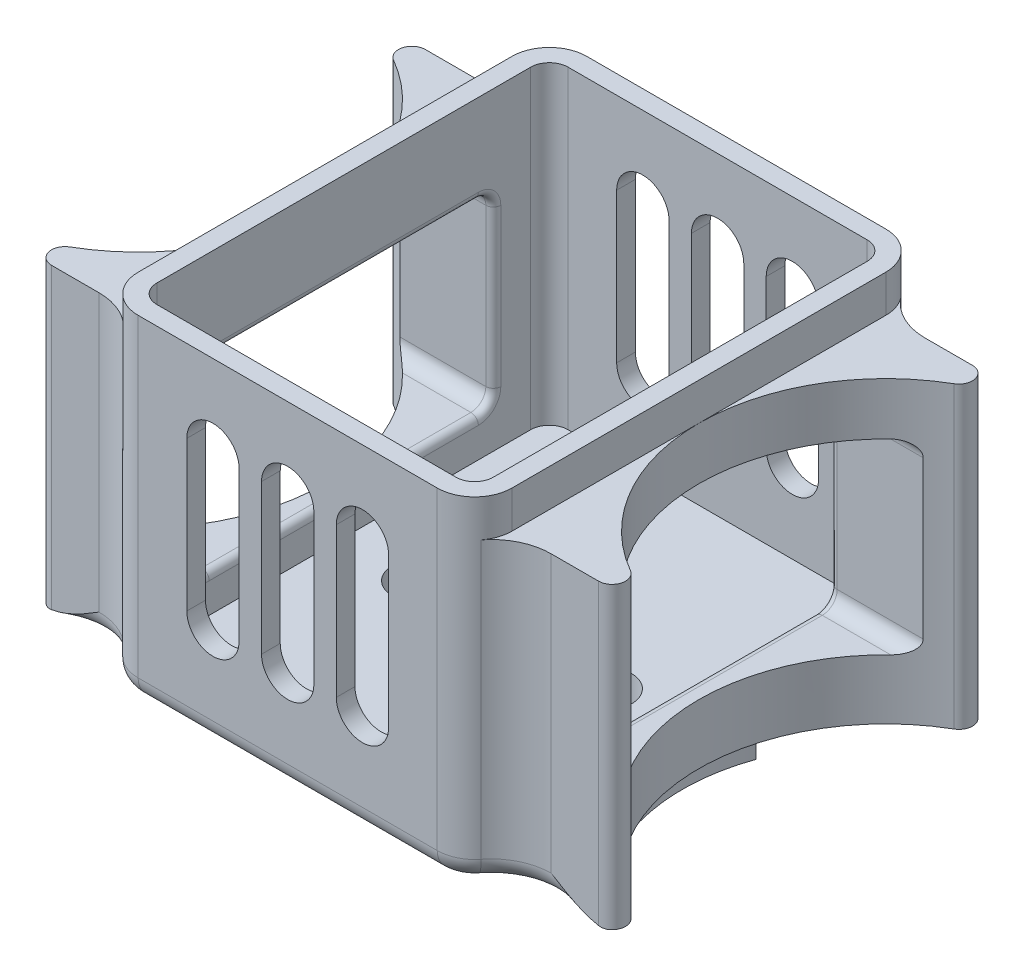
from build123d import *

# Parameters (mm, degrees)
SALIENTE_EXTRUIR1_DEPTH    = 45
CORTAR_EXTRUIR1_DEPTH      = 42
CORTAR_EXTRUIR2_START      = -5
CORTAR_EXTRUIR2_DEPTH      = 5
CROQUIS6_W                 = 30
CROQUIS6_H                 = 2
SALIENTE_EXTRUIR3_DEPTH    = 5
SALIENTE_EXTRUIR4_DEPTH    = 3.5
CORTAR_EXTRUIR5_DEPTH      = 74.654599313
CORTAR_EXTRUIR5_DEPTH_BACK = 74.654599313
REDONDEO1_R                = 1.8
REDONDEO5_R                = 8
REDONDEO6_R                = 8
REDONDEO7_R                = 3
REDONDEO8_R                = 3
CORTAR_EXTRUIR6_DEPTH      = 83.489697253
CORTAR_EXTRUIR6_DEPTH_BACK = 83.489697253
CORTAR_EXTRUIR7_DEPTH      = 69.742637081
CORTAR_EXTRUIR7_DEPTH_BACK = 10
CROQUIS9_R                 = 1.55
REDONDEO9_R                = 1
CROQUIS14_R                = 3.5
CORTAR_EXTRUIR8_DEPTH      = 4


with BuildPart() as part:
    # Croquis1 → Saliente-Extruir1 (new body)
    with BuildSketch(Plane(origin=(0, 0, 0), x_dir=(1, 0, 0), z_dir=(0, 1, 0))):
        with BuildLine():
            Line((20, 30), (-20, 30))
            ThreePointArc((-20, 30), (-23.535533906, 28.535533906), (-25, 25))
            Line((-25, 25), (-25, -25))
            ThreePointArc((-25, -25), (-23.535533906, -28.535533906), (-20, -30))
            Line((-20, -30), (20, -30))
            ThreePointArc((20, -30), (23.535533906, -28.535533906), (25, -25))
            Line((25, -25), (25, 25))
            ThreePointArc((25, 25), (23.535533906, 28.535533906), (20, 30))
        make_face()
        with BuildLine():
            ThreePointArc((-50, 25), (-32.32233048, 17.677669539), (-25, 2.6e-08))
            Line((-25, 2.6e-08), (-25, 25))
            Line((-25, 25), (-50, 25))
        make_face()
        with BuildLine():
            Line((-50, -25), (-25, -25))
            Line((-25, -25), (-25, 2.6e-08))
            ThreePointArc((-25, 2.6e-08), (-32.322330461, -17.67766952), (-50, -25))
        make_face()
        with BuildLine():
            Line((25, 3.4e-08), (25, -25))
            Line((25, -25), (50, -25))
            ThreePointArc((50, -25), (32.322330458, -17.677669518), (25, 3.4e-08))
        make_face()
        with BuildLine():
            Line((25, 25), (25, 3.4e-08))
            ThreePointArc((25, 3.4e-08), (32.322330482, 17.677669542), (50, 25))
            Line((50, 25), (25, 25))
        make_face()
    extrude(amount=SALIENTE_EXTRUIR1_DEPTH)

    # Croquis2 → Cortar-Extruir1 (cut)
    with BuildSketch(Plane(origin=(0, 45, 0), x_dir=(1, 0, 0), z_dir=(0, 1, 0))):
        with BuildLine():
            Line((22.5, 25), (22.5, -25))
            ThreePointArc((22.5, -25), (21.767766953, -26.767766953), (20, -27.5))
            Line((20, -27.5), (-20, -27.5))
            ThreePointArc((-20, -27.5), (-21.767766953, -26.767766953), (-22.5, -25))
            Line((-22.5, -25), (-22.5, 25))
            ThreePointArc((-22.5, 25), (-21.767766953, 26.767766953), (-20, 27.5))
            Line((-20, 27.5), (20, 27.5))
            ThreePointArc((20, 27.5), (21.767766953, 26.767766953), (22.5, 25))
        make_face()
    extrude(amount=-CORTAR_EXTRUIR1_DEPTH, mode=Mode.SUBTRACT)

    # Croquis5 → Cortar-Extruir2 (cut)
    with BuildSketch(Plane(origin=(0, 45, 0), x_dir=(1, 0, 0), z_dir=(0, 1, 0)).offset(CORTAR_EXTRUIR2_START)):
        with BuildLine():
            Line((-25, 9.7e-08), (-25, 25))
            Line((-25, 25), (-50, 25))
            ThreePointArc((-50, 25), (-32.322330505, 17.677669564), (-25, 9.7e-08))
        make_face()
        with BuildLine():
            Line((-25, -25), (-25, 9.7e-08))
            ThreePointArc((-25, 9.7e-08), (-32.322330436, -17.677669495), (-50, -25))
            Line((-50, -25), (-25, -25))
        make_face()
        with BuildLine():
            Line((50, 25), (25, 25))
            Line((25, 25), (25, 0))
            ThreePointArc((25, 0), (32.32233047, 17.67766953), (50, 25))
        make_face()
        with BuildLine():
            ThreePointArc((50, -25), (32.32233047, -17.67766953), (25, 0))
            Line((25, 0), (25, -25))
            Line((25, -25), (50, -25))
        make_face()
    extrude(amount=CORTAR_EXTRUIR2_DEPTH, mode=Mode.SUBTRACT)

    # Croquis6 → Saliente-Extruir3 (add)
    with BuildSketch(Plane.XZ):
        with Locations((0, 16.1)):
            Rectangle(CROQUIS6_W, CROQUIS6_H)
        with Locations((0, -16.1)):
            Rectangle(CROQUIS6_W, CROQUIS6_H)
    extrude(amount=SALIENTE_EXTRUIR3_DEPTH)

    # Croquis8 → Saliente-Extruir4 (add)
    with BuildSketch(Plane.XZ):
        with BuildLine():
            Line((24.25, 8.375), (-24.25, 8.375))
            ThreePointArc((-24.25, 8.375), (-22.80545319, 0), (-24.25, -8.375))
            Line((-24.25, -8.375), (24.25, -8.375))
            ThreePointArc((24.25, -8.375), (22.80545319, 0), (24.25, 8.375))
        make_face()
    extrude(amount=SALIENTE_EXTRUIR4_DEPTH)

    # Croquis12 → Cortar-Extruir5 (cut, two sides: drawn at the far end of the back side and taken through both)
    with BuildSketch(Plane(origin=(0, 0, 0), x_dir=(0, 0, -1), z_dir=(1, 0, 0)).offset(-CORTAR_EXTRUIR5_DEPTH_BACK)):
        with BuildLine():
            Line((-18, 8), (18, 8))
            ThreePointArc((18, 8), (19.414213562, 8.585786438), (20, 10))
            Line((20, 10), (20, 31))
            ThreePointArc((20, 31), (19.414213562, 32.414213562), (18, 33))
            Line((18, 33), (-18, 33))
            ThreePointArc((-18, 33), (-19.414213562, 32.414213562), (-20, 31))
            Line((-20, 31), (-20, 10))
            ThreePointArc((-20, 10), (-19.414213562, 8.585786438), (-18, 8))
        make_face()
    extrude(amount=CORTAR_EXTRUIR5_DEPTH + CORTAR_EXTRUIR5_DEPTH_BACK, mode=Mode.SUBTRACT)

    # Redondeo1
    redondeo1_edges = [part.edges().sort_by_distance(p)[0] for p in [
        (-50, 20, -25),
    ]]
    fillet(redondeo1_edges, radius=REDONDEO1_R)
    redondeo1_2_edges = [part.edges().sort_by_distance(p)[0] for p in [
        (50, 20, 25),
    ]]
    fillet(redondeo1_2_edges, radius=REDONDEO1_R)
    redondeo1_3_edges = [part.edges().sort_by_distance(p)[0] for p in [
        (-50, 20, 25),
    ]]
    fillet(redondeo1_3_edges, radius=REDONDEO1_R)
    redondeo1_4_edges = [part.edges().sort_by_distance(p)[0] for p in [
        (50, 20, -25),
    ]]
    fillet(redondeo1_4_edges, radius=REDONDEO1_R)

    # Redondeo5
    redondeo5_edges = [part.edges().sort_by_distance(p)[0] for p in [
        (25, 20, 25),
        (-25, 20, -25),
        (25, 20, -25),
        (-25, 20, 25),
    ]]
    fillet(redondeo5_edges, radius=REDONDEO5_R)

    # Redondeo6
    # the kernel refuses this fillet: 8 mm, written as the material it adds along each edge
    with BuildSketch(Plane(origin=(-15, 0, -17.1), x_dir=(0, 0, -1), z_dir=(1, 0, 0))) as redondeo6_piece_1:
        with BuildLine():
            CenterArc((7.416198487, -8), REDONDEO6_R, 90, 67.975687163)
            Line((0, -5), (-0.14832397, -4.94))
            ThreePointArc((-0.14832397, -4.94), (-0.16, -2.5), (-0.16, 0))
            Line((-0.16, 0), (0, 0.16))
            Line((0, 0.16), (7.416198487, 0.16))
            Line((7.416198487, 0.16), (7.416198487, 0))
        make_face()
    extrude(amount=30)
    with BuildSketch(Plane(origin=(-15, 0, 17.1), x_dir=(0, 0, 1), z_dir=(1, 0, 0))) as redondeo6_piece_2:
        with BuildLine():
            CenterArc((7.416198487, 8), REDONDEO6_R, 202.024312837, 67.975687163)
            Line((0, 5), (-0.14832397, 4.94))
            ThreePointArc((-0.14832397, 4.94), (-0.16, 2.5), (-0.16, 0))
            Line((-0.16, 0), (0, -0.16))
            Line((0, -0.16), (7.416198487, -0.16))
            Line((7.416198487, -0.16), (7.416198487, 0))
        make_face()
    extrude(amount=30)

    # Redondeo7
    # the kernel refuses this fillet: 3 mm, written as the material it takes off along each edge
    with BuildSketch(Plane(origin=(20, 0, 25), x_dir=(0, 0, 1), z_dir=(-1, 0, 0))) as redondeo7_piece_1:
        with BuildLine():
            CenterArc((5 - REDONDEO7_R, REDONDEO7_R), REDONDEO7_R, 270, 90)
            Line((5, REDONDEO7_R), (5, 0))
            Line((5, 0), (5 - REDONDEO7_R, 0))
        make_face()
    revolve(axis=Axis((20, 0, 25), (0, 1, 0)), revolution_arc=52.020127555, mode=Mode.SUBTRACT)
    with BuildSketch(Plane(origin=(-20, 0, 30), x_dir=(0, 0, -1), z_dir=(1, 0, 0)), Plane(origin=(20, 0, -30), x_dir=(0, 0, 1), z_dir=(-1, 0, 0))) as redondeo7_piece_2:
        with BuildLine():
            CenterArc((REDONDEO7_R, REDONDEO7_R), REDONDEO7_R, 180, 90)
            Line((0, REDONDEO7_R), (0, 0))
            Line((0, 0), (REDONDEO7_R, 0))
        make_face()
    extrude(amount=40, mode=Mode.SUBTRACT)
    with BuildSketch(Plane(origin=(-20, 0, -25), x_dir=(0, 0, -1), z_dir=(1, 0, 0))) as redondeo7_piece_3:
        with BuildLine():
            CenterArc((5 - REDONDEO7_R, REDONDEO7_R), REDONDEO7_R, 270, 90)
            Line((5, REDONDEO7_R), (5, 0))
            Line((5, 0), (5 - REDONDEO7_R, 0))
        make_face()
    revolve(axis=Axis((-20, 0, -25), (0, 1, 0)), revolution_arc=52.020127555, mode=Mode.SUBTRACT)
    with BuildSketch(Plane(origin=(20, 0, -25), x_dir=(0.7882269819968925, 0, -0.6153846153846151), z_dir=(0.6153846153846151, 0, 0.7882269819968925))) as redondeo7_piece_4:
        with BuildLine():
            CenterArc((5 - REDONDEO7_R, REDONDEO7_R), REDONDEO7_R, 270, 90)
            Line((5, REDONDEO7_R), (5, 0))
            Line((5, 0), (5 - REDONDEO7_R, 0))
        make_face()
    revolve(axis=Axis((20, 0, -25), (0, 1, 0)), revolution_arc=52.020127555, mode=Mode.SUBTRACT)
    with BuildSketch(Plane(origin=(-20, 0, 25), x_dir=(-0.7882269819968919, 0, 0.6153846153846159), z_dir=(-0.6153846153846159, 0, -0.7882269819968919))) as redondeo7_piece_5:
        with BuildLine():
            CenterArc((5 - REDONDEO7_R, REDONDEO7_R), REDONDEO7_R, 270, 90)
            Line((5, REDONDEO7_R), (5, 0))
            Line((5, 0), (5 - REDONDEO7_R, 0))
        make_face()
    revolve(axis=Axis((-20, 0, 25), (0, 1, 0)), revolution_arc=52.020127555, mode=Mode.SUBTRACT)
    with BuildSketch(Plane(origin=(30.246950766, 0, -33), x_dir=(0.8061555471519356, 0, 0.5917036705954792), z_dir=(0.5917036705954792, 0, -0.8061555471519356))) as redondeo7_piece_6:
        with BuildLine():
            CenterArc((8 + REDONDEO7_R, -REDONDEO7_R), REDONDEO7_R, 90, 90)
            Line((8, -REDONDEO7_R), (8, 0))
            Line((8, 0), (8 + REDONDEO7_R, 0))
        make_face()
    revolve(axis=Axis((30.246950766, 0, -33), (0, -1, 0)), revolution_arc=105.742128289, mode=Mode.SUBTRACT)
    with BuildSketch(Plane(origin=(-30.246950766, 0, -33), x_dir=(0.7882269819968922, 0, 0.6153846153846155), z_dir=(0.6153846153846155, 0, -0.7882269819968922))) as redondeo7_piece_7:
        with BuildLine():
            CenterArc((8 + REDONDEO7_R, -REDONDEO7_R), REDONDEO7_R, 90, 90)
            Line((8, -REDONDEO7_R), (8, 0))
            Line((8, 0), (8 + REDONDEO7_R, 0))
        make_face()
    revolve(axis=Axis((-30.246950766, 0, -33), (0, -1, 0)), revolution_arc=105.742128289, mode=Mode.SUBTRACT)
    with BuildSketch(Plane(origin=(30.246950766, 0, 33), x_dir=(0.8061555471519357, 0, -0.591703670595479), z_dir=(0.591703670595479, 0, 0.8061555471519357))) as redondeo7_piece_8:
        with BuildLine():
            CenterArc((8 + REDONDEO7_R, REDONDEO7_R), REDONDEO7_R, 180, 90)
            Line((8, REDONDEO7_R), (8, 0))
            Line((8, 0), (8 + REDONDEO7_R, 0))
        make_face()
    revolve(axis=Axis((30.246950766, 0, 33), (0, 1, 0)), revolution_arc=105.742128289, mode=Mode.SUBTRACT)
    with BuildSketch(Plane(origin=(-30.246950766, 0, 33), x_dir=(0.7882269819968923, 0, -0.6153846153846152), z_dir=(0.6153846153846152, 0, 0.7882269819968923))) as redondeo7_piece_9:
        with BuildLine():
            CenterArc((8 + REDONDEO7_R, REDONDEO7_R), REDONDEO7_R, 180, 90)
            Line((8, REDONDEO7_R), (8, 0))
            Line((8, 0), (8 + REDONDEO7_R, 0))
        make_face()
    revolve(axis=Axis((-30.246950766, 0, 33), (0, 1, 0)), revolution_arc=105.742128289, mode=Mode.SUBTRACT)

    # Redondeo8
    redondeo8_edges = [part.edges().sort_by_distance(p)[0] for p in [
        (0, -5, -17.1),
        (0, -5, 17.1),
    ]]
    fillet(redondeo8_edges, radius=REDONDEO8_R)

    # Croquis13 → Cortar-Extruir6 (cut, two sides: drawn at the far end of the back side and taken through both)
    with BuildSketch(Plane.XY.offset(-27.5).offset(-CORTAR_EXTRUIR6_DEPTH_BACK)):
        with BuildLine():
            Line((-6.5, 34), (-6.5, 14))
            ThreePointArc((-6.5, 14), (-10, 10.5), (-13.5, 14))
            Line((-13.5, 14), (-13.5, 34))
            ThreePointArc((-13.5, 34), (-10, 37.5), (-6.5, 34))
        make_face()
        with BuildLine():
            Line((3.5, 34), (3.5, 14))
            ThreePointArc((3.5, 14), (0, 10.5), (-3.5, 14))
            Line((-3.5, 14), (-3.5, 34))
            ThreePointArc((-3.5, 34), (0, 37.5), (3.5, 34))
        make_face()
        with BuildLine():
            Line((13.5, 34), (13.5, 14))
            ThreePointArc((13.5, 14), (10, 10.5), (6.5, 14))
            Line((6.5, 14), (6.5, 34))
            ThreePointArc((6.5, 34), (10, 37.5), (13.5, 34))
        make_face()
    extrude(amount=CORTAR_EXTRUIR6_DEPTH + CORTAR_EXTRUIR6_DEPTH_BACK, mode=Mode.SUBTRACT)

    # Croquis9 → Cortar-Extruir7 (cut, two sides: drawn at the far end of the back side and taken through both)
    with BuildSketch(Plane.XZ.offset(3.5).offset(-CORTAR_EXTRUIR7_DEPTH_BACK)):
        with Locations(Location((-12.5, 0, 0), (0, 0, 90))):
            Circle(CROQUIS9_R)
        with Locations(Location((12.5, 0, 0), (0, 0, 90))):
            Circle(CROQUIS9_R)
    extrude(amount=CORTAR_EXTRUIR7_DEPTH + CORTAR_EXTRUIR7_DEPTH_BACK, mode=Mode.SUBTRACT)

    # Redondeo9
    redondeo9_edges = [part.edges().sort_by_distance(p)[0] for p in [
        (-22.5, 20.5, -20),
        (-22.5, 32.414213562, -19.414213562),
        (-22.5, 33, 0),
        (-22.5, 32.414213562, 19.414213562),
        (-22.5, 20.5, 20),
        (-22.5, 8.585786438, 19.414213562),
        (-22.5, 8, 0),
        (-22.5, 8.585786438, -19.414213562),
        (22.5, 8.585786438, -19.414213562),
        (22.5, 8, 0),
        (22.5, 8.585786438, 19.414213562),
        (22.5, 20.5, 20),
        (22.5, 32.414213562, 19.414213562),
        (22.5, 33, 0),
        (22.5, 32.414213562, -19.414213562),
        (22.5, 20.5, -20),
    ]]
    fillet(redondeo9_edges, radius=REDONDEO9_R)

    # Croquis14 → Cortar-Extruir8 (cut)
    with BuildSketch(Plane(origin=(0, 3, 0), x_dir=(1, 0, 0), z_dir=(0, 1, 0))):
        with Locations(Location((-12.5, 0, 0), (0, 0, 270))):
            Circle(CROQUIS14_R)
        with Locations(Location((12.5, 0, 0), (0, 0, 270))):
            Circle(CROQUIS14_R)
    extrude(amount=-CORTAR_EXTRUIR8_DEPTH, mode=Mode.SUBTRACT)


solid = part.part
